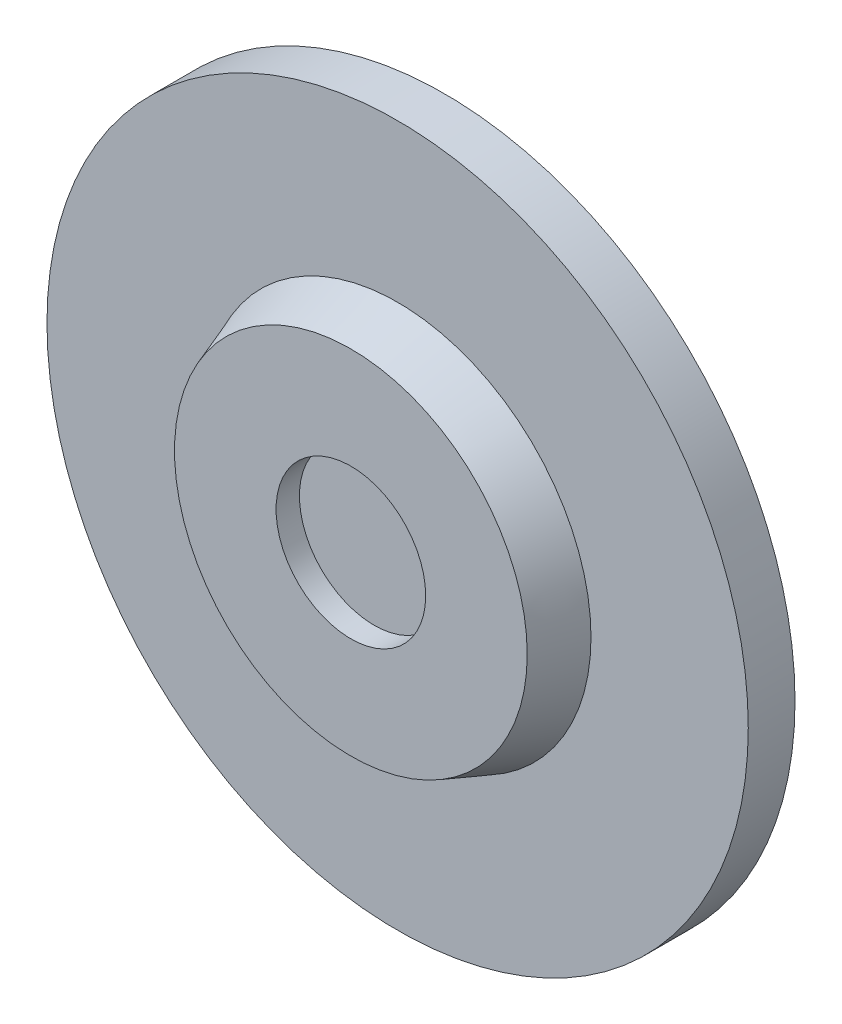
from build123d import *

# Parameters (mm, degrees)
SKETCH1_R           = 7.5
BOSS_EXTRUDE1_DEPTH = 1
SKETCH4_R           = 4.5
BOSS_EXTRUDE2_DEPTH = 1
SKETCH5_R           = 1.6
CUT_EXTRUDE2_DEPTH  = 0.5
CHAMFER4_SIZE       = 2
CHAMFER4_SIZE_2     = 0.727940469
SKETCH6_R           = 1.5
CUT_EXTRUDE3_DEPTH  = 0.5


with BuildPart() as part:
    # Sketch1 → Boss-Extrude1 (new body)
    with BuildSketch(Plane.XY):
        Circle(SKETCH1_R)
    extrude(amount=BOSS_EXTRUDE1_DEPTH)

    # Sketch4 → Boss-Extrude2 (add)
    with BuildSketch(Plane.XY.offset(1)):
        Circle(SKETCH4_R)
    extrude(amount=BOSS_EXTRUDE2_DEPTH)

    # Sketch5 → Cut-Extrude2 (cut)
    with BuildSketch(Plane.XY.offset(2)):
        Circle(SKETCH5_R)
    extrude(amount=-CUT_EXTRUDE2_DEPTH, mode=Mode.SUBTRACT)

    # Chamfer4
    # the kernel refuses this chamfer: 2, 0.727940469 mm, written as the material it takes off along each edge
    with BuildSketch(Plane(origin=(0, 0, 2), x_dir=(1, 0, 0), z_dir=(0, -1, 0))) as chamfer4_piece_1_section:
        Polygon((4.5, -CHAMFER4_SIZE), (4.5 - CHAMFER4_SIZE_2, 0), (4.5, 0), align=None)
    chamfer4_piece_1 = revolve(axis=Axis((0, 0, 2), (0, 0, 1)), mode=Mode.PRIVATE)
    chamfer4_piece_1 = split(chamfer4_piece_1, bisect_by=Plane(origin=(-3.964304639, 0, 1), z_dir=(0, 0, 1)), keep=Keep.TOP, mode=Mode.PRIVATE)
    add(chamfer4_piece_1, mode=Mode.SUBTRACT)

    # Sketch6 → Cut-Extrude3 (cut)
    with BuildSketch(Plane(origin=(0, 0, 0), x_dir=(-1, 0, 0), z_dir=(0, 0, -1))):
        Circle(SKETCH6_R)
        with Locations((-4, 0)):
            Circle(SKETCH6_R)
        with Locations((0, 4)):
            Circle(SKETCH6_R)
        with Locations((4, 0)):
            Circle(SKETCH6_R)
        with Locations((0, -4)):
            Circle(SKETCH6_R)
    extrude(amount=-CUT_EXTRUDE3_DEPTH, mode=Mode.SUBTRACT)


solid = part.part
